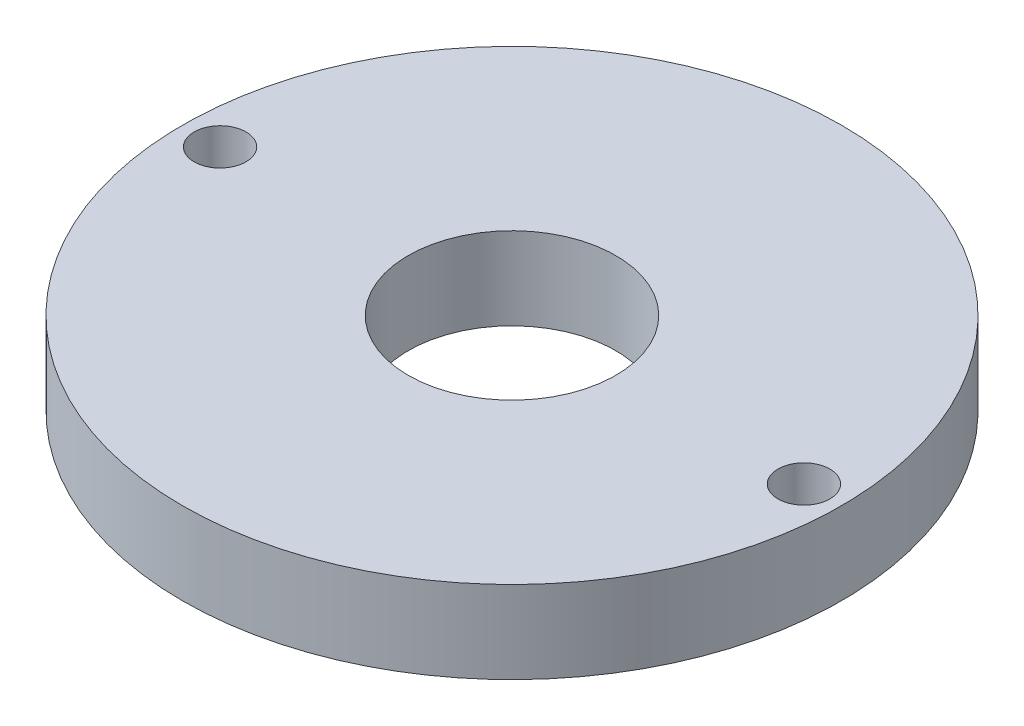
from build123d import *

# Parameters (mm, degrees)
SKETCH1_R           = 50.8
SKETCH1_R_2         = 16
BOSS_EXTRUDE1_DEPTH = 12.7
SKETCH2_R           = 4
CUT_EXTRUDE1_DEPTH  = 12.7


with BuildPart() as part:
    # Sketch1 → Boss-Extrude1 (new body)
    with BuildSketch(Plane(origin=(0, 0, 0), x_dir=(1, 0, 0), z_dir=(0, 1, 0))):
        Circle(SKETCH1_R)
        Circle(SKETCH1_R_2, mode=Mode.SUBTRACT)
    extrude(amount=BOSS_EXTRUDE1_DEPTH)

    # Sketch2 → Cut-Extrude1 (cut)
    with BuildSketch(Plane(origin=(0, 12.7, 0), x_dir=(1, 0, 0), z_dir=(0, 1, 0))):
        with Locations((45, 0)):
            Circle(SKETCH2_R)
        with Locations((-45, 0)):
            Circle(SKETCH2_R)
    extrude(amount=-CUT_EXTRUDE1_DEPTH, mode=Mode.SUBTRACT)


solid = part.part
